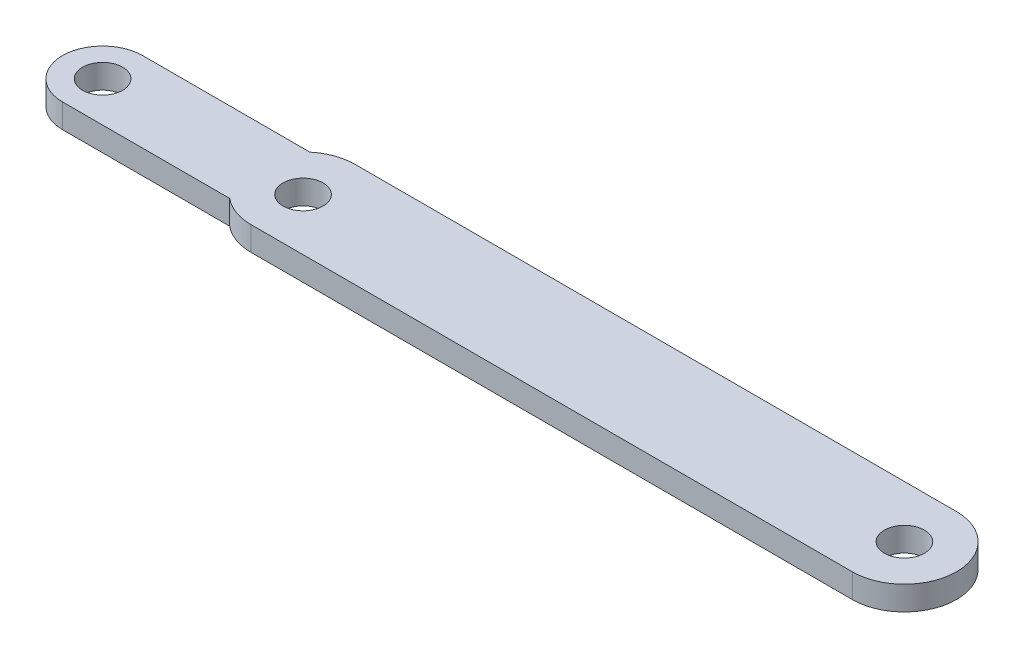
from build123d import *

# Parameters (mm, degrees)
SKETCH2_R           = 2.5
BOSS_EXTRUDE1_DEPTH = 3


with BuildPart() as part:
    # Sketch2 → Boss-Extrude1 (new body)
    with BuildSketch(Plane(origin=(0, 0, 0), x_dir=(1, 0, 0), z_dir=(0, 1, 0))):
        with BuildLine():
            Line((87.593623105, 198.818492307), (12.593623105, 198.818492307))
            ThreePointArc((12.593623105, 198.818492307), (10.385682888, 198.432001937), (8.440311173, 197.318492307))
            Line((8.440311173, 197.318492307), (-12.406376895, 197.318492307))
            ThreePointArc((-12.406376895, 197.318492307), (-17.406376895, 192.318492307), (-12.406376895, 187.318492307))
            Line((-12.406376895, 187.318492307), (8.440311173, 187.318492307))
            ThreePointArc((8.440311173, 187.318492307), (10.385682888, 186.204982677), (12.593623105, 185.818492307))
            Line((12.593623105, 185.818492307), (87.593623105, 185.818492307))
            ThreePointArc((87.593623105, 185.818492307), (94.093623105, 192.318492307), (87.593623105, 198.818492307))
        make_face()
        with Locations((12.593623105, 192.318492307)):
            Circle(SKETCH2_R, mode=Mode.SUBTRACT)
        with Locations((87.593623105, 192.318492307)):
            Circle(SKETCH2_R, mode=Mode.SUBTRACT)
        with Locations((-12.406376895, 192.318492307)):
            Circle(SKETCH2_R, mode=Mode.SUBTRACT)
    extrude(amount=BOSS_EXTRUDE1_DEPTH)


solid = part.part
